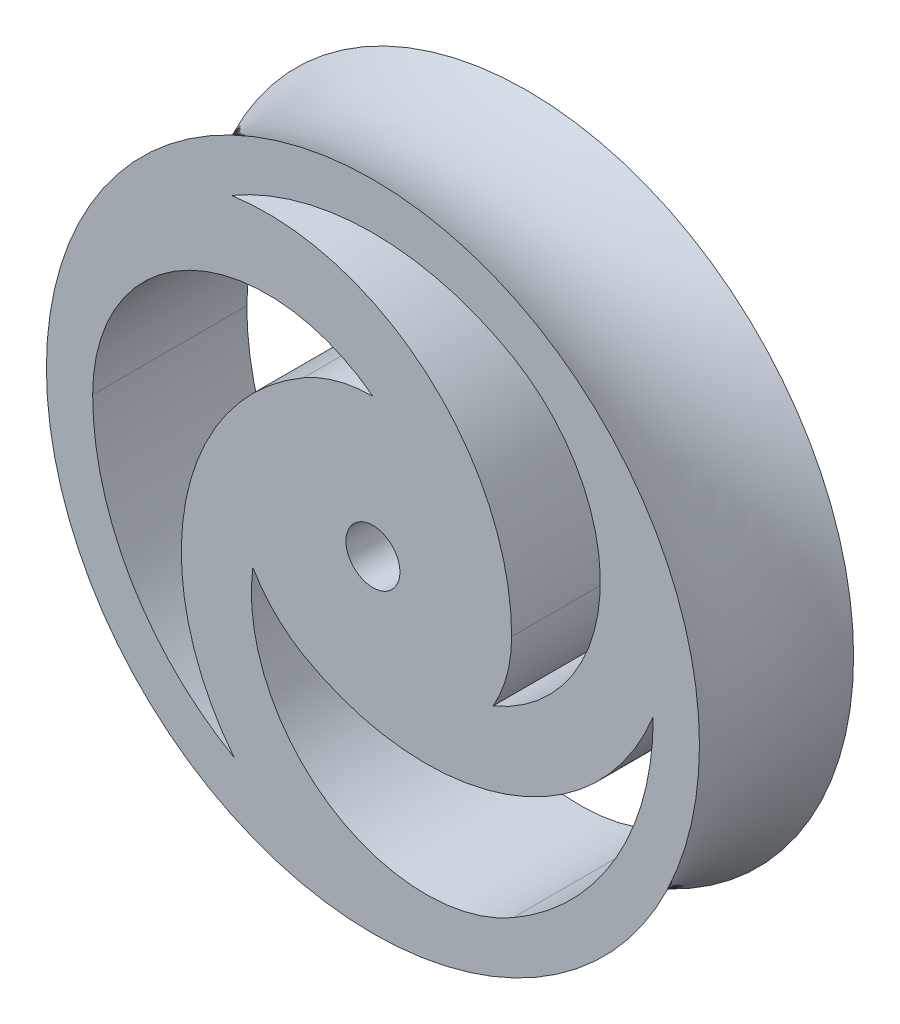
from build123d import *
from build123d.topology import SkipClean

# Parameters (mm, degrees)
SKETCH3_R           = 1.75
CUT_EXTRUDE1_DEPTH  = 32.583508329
BOSS_EXTRUDE1_START = 8
SKETCH4_R           = 9
SKETCH4_R_2         = 1.75
BOSS_EXTRUDE1_DEPTH = 8
SKETCH5_R           = 1.65
CUT_EXTRUDE2_DEPTH  = 33.657587148
CUT_EXTRUDE3_DEPTH  = 2.7


with BuildPart() as part:
    # Sketch2 → Revolve1 (revolve)
    with BuildSketch(Plane(origin=(0, 0, 0), x_dir=(1, 0, 0), z_dir=(0, 1, 0))):
        with BuildLine():
            Line((0, 5), (0, -5))
            Line((0, -5), (21.183932571, -5))
            ThreePointArc((21.183932571, -5), (20, 0), (21.183932571, 5))
            Line((21.183932571, 5), (0, 5))
        make_face()
    revolve(axis=Axis((0, 0, -5), (0, 0, 1)))

    # Sketch3 → Cut-Extrude1 (cut, through all)
    with BuildSketch(Plane(origin=(0, 0, -5), x_dir=(-1, 0, 0), z_dir=(0, 0, -1))):
        Circle(SKETCH3_R)
        with BuildLine():
            ThreePointArc((0, 9), (11.88574137, 10.144646418), (18.183932571, 0))
            ThreePointArc((18.183932571, 0), (15.721086782, -9.137988517), (8.999688864, -15.800664673))
            ThreePointArc((8.999688864, -15.800664673), (12.15151006, -2.973087713), (4.5, 7.794228634))
            ThreePointArc((4.5, 7.794228634), (2.329371406, 8.693332437), (0, 9))
        make_face()
        with BuildLine():
            ThreePointArc((7.794228634, -4.5), (6.363961031, -6.363961031), (4.5, -7.794228634))
            ThreePointArc((4.5, -7.794228634), (-8.650524517, -9.03697255), (-18.183621435, 0.106373154))
            ThreePointArc((-18.183621435, 0.106373154), (-15.774273586, -9.04586627), (-9.091966285, -15.747747547))
            ThreePointArc((-9.091966285, -15.747747547), (2.842650825, -15.365677178), (7.794228634, -4.5))
        make_face()
        with BuildLine():
            ThreePointArc((-7.794228634, -4.5), (-8.693332437, -2.329371406), (-9, 0))
            ThreePointArc((-9, 0), (-3.500985543, 12.010060262), (9.183932571, 15.694291519))
            ThreePointArc((9.183932571, 15.694291519), (0.053186804, 18.183854787), (-9.091966285, 15.747747547))
            ThreePointArc((-9.091966285, 15.747747547), (-14.728392195, 5.221030761), (-7.794228634, -4.5))
        make_face()
    extrude(amount=-CUT_EXTRUDE1_DEPTH, mode=Mode.SUBTRACT)

    # Sketch4 → Boss-Extrude1 (add)
    with SkipClean():  # the faces are left unmerged after this step: merging them gives an invalid solid
        with BuildSketch(Plane(origin=(0, 0, -5), x_dir=(-1, 0, 0), z_dir=(0, 0, -1)).offset(BOSS_EXTRUDE1_START)):
            Circle(SKETCH4_R)
            Circle(SKETCH4_R_2, mode=Mode.SUBTRACT)
        extrude(amount=-BOSS_EXTRUDE1_DEPTH)

    # Sketch5 → Cut-Extrude2 (cut, through all)
    with SkipClean():  # the faces are left unmerged after this step: merging them gives an invalid solid
        with BuildSketch(Plane(origin=(0, 0, 0), x_dir=(0, 0, -1), z_dir=(1, 0, 0))):
            with Locations((9, 0)):
                Circle(SKETCH5_R)
        extrude(amount=-CUT_EXTRUDE2_DEPTH, mode=Mode.SUBTRACT)

    # Sketch6 → Cut-Extrude3 (cut)
    with SkipClean():  # the faces are left unmerged after this step: merging them gives an invalid solid
        with BuildSketch(Plane(origin=(-2.7, 0, 0), x_dir=(0, 0, -1), z_dir=(1, 0, 0))):
            Polygon((10.645448267, 2.85), (13, 2.85), (13, -2.85), (10.645448267, -2.85), (7.354551733, -2.85), (5.709103466, 0), (7.354551733, 2.85), align=None)
        extrude(amount=-CUT_EXTRUDE3_DEPTH, mode=Mode.SUBTRACT)


solid = part.part
